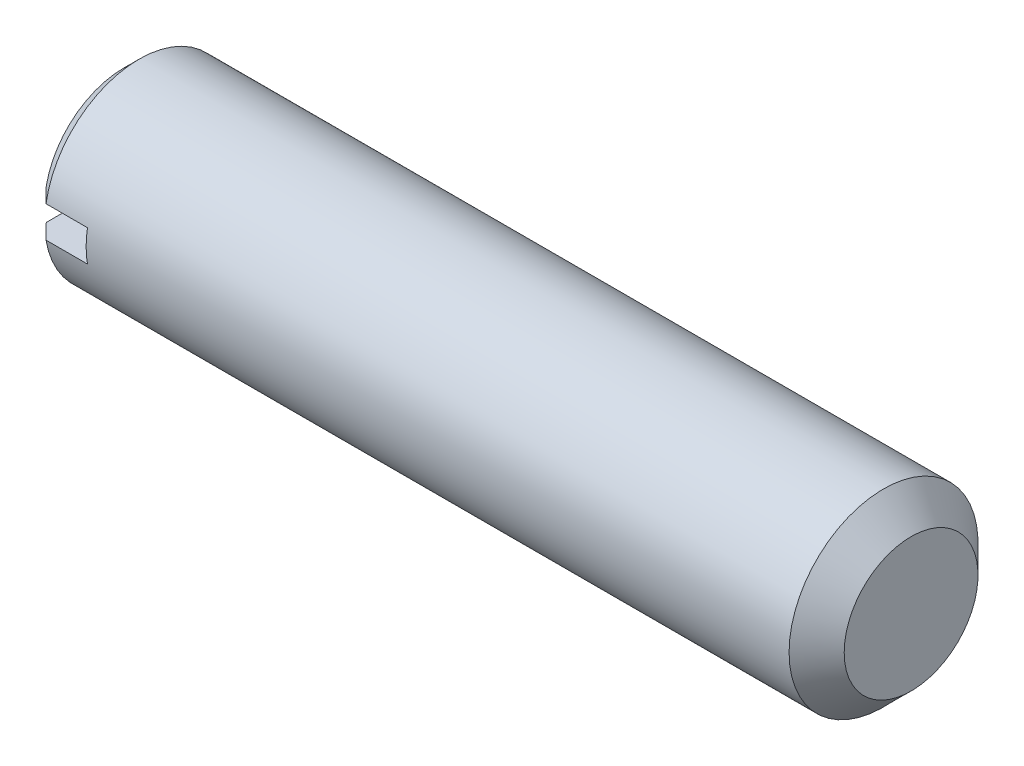
from build123d import *

# Parameters (mm, degrees)
SLOTSKE_W  = 12
SLOTSKE_H  = 2
SLOT_DEPTH = 3.6


with BuildPart() as part:
    # BodySke → BaseBody (revolve)
    with BuildSketch(Plane.XY):
        Polygon((0, 0), (0, 5.036), (0.964, 6), (48.25, 6), (50, 4.25), (50, 0), align=None)
    revolve(axis=Axis((0, 0, 0), (1, 0, 0)))

    # SlotSke → Slot (cut)
    with BuildSketch(Plane(origin=(0, 0, 0), x_dir=(0, 0, -1), z_dir=(1, 0, 0))):
        Rectangle(SLOTSKE_W, SLOTSKE_H)
    extrude(amount=SLOT_DEPTH, mode=Mode.SUBTRACT)


solid = part.part
